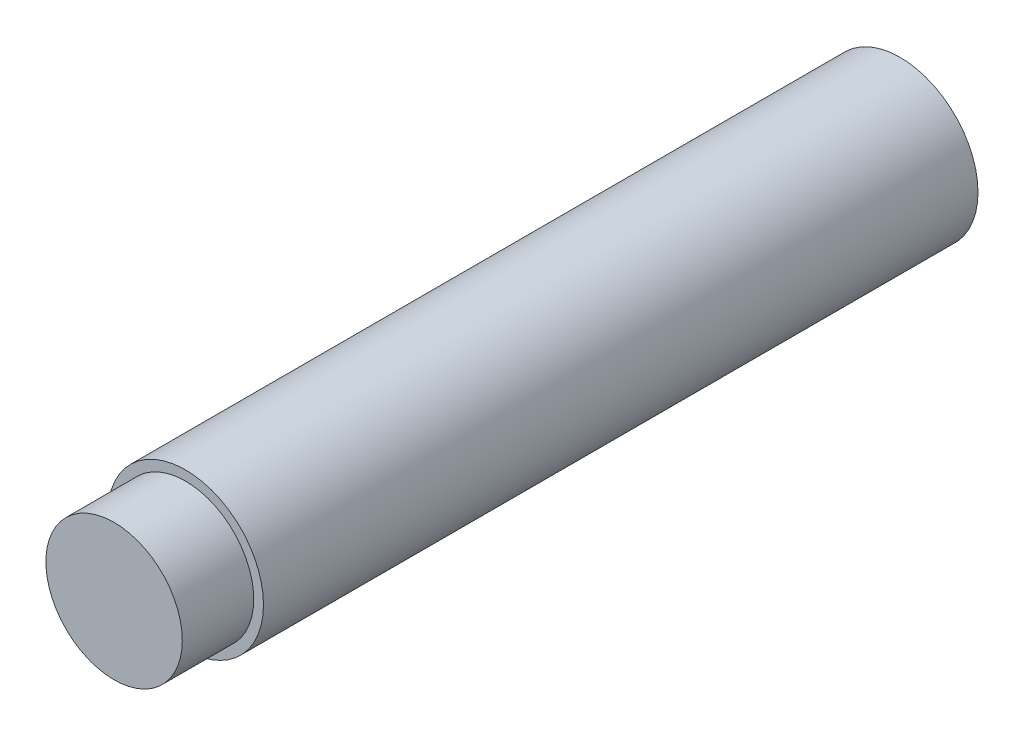
from build123d import *

# Parameters (mm, degrees)
SKETCH_1_R      = 6
EXTRUDE_1_DEPTH = 55
SKETCH_2_R      = 5.25
EXTRUDE_2_DEPTH = 5.5


with BuildPart() as part:
    # Эскиз1 → Бобышка-Вытянуть1 (new body)
    with BuildSketch(Plane.XY):
        Circle(SKETCH_1_R)
    extrude(amount=EXTRUDE_1_DEPTH)

    # Эскиз2 → Бобышка-Вытянуть2 (add)
    with BuildSketch(Plane.XY.offset(55)):
        Circle(SKETCH_2_R)
    extrude(amount=EXTRUDE_2_DEPTH)


solid = part.part
